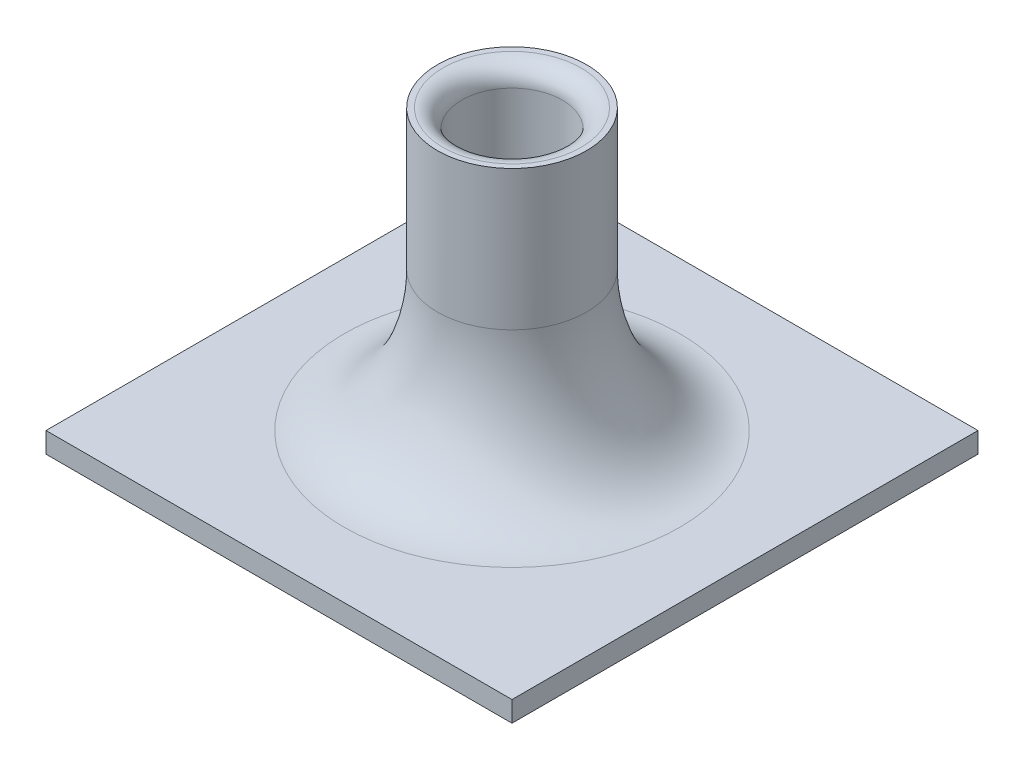
from build123d import *
from OCP.BRepFilletAPI import BRepFilletAPI_MakeChamfer

# Parameters (mm, degrees)
SKETCH_1_W          = 50
SKETCH_1_H          = 50
EXTRUDE_1_DEPTH     = 5
SKETCH_5_R          = 8
EXTRUDE_3_DEPTH     = 30
SKETCH_6_R          = 5.4
CUT_EXTRUDE_2_DEPTH = 50.749371855
FILLET_3_R          = 2
FILLET_2_SIZE       = 15
FILLET_2_SIZE_2     = 10
CHAMFER_1_SIZE      = 6
CHAMFER_1_SIZE2     = 2.797845949


with BuildPart() as part:
    # Эскиз1 → Бобышка-Вытянуть1 (new body)
    with BuildSketch(Plane(origin=(0, 0, 0), x_dir=(1, 0, 0), z_dir=(0, 1, 0))):
        Rectangle(SKETCH_1_W, SKETCH_1_H)
    extrude(amount=EXTRUDE_1_DEPTH)

    # Эскиз5 → Бобышка-Вытянуть3 (add)
    with BuildSketch(Plane(origin=(0, 5, 0), x_dir=(1, 0, 0), z_dir=(0, 1, 0))):
        with Locations(Location((0, 0, 0), (0, 0, 270))):
            Circle(SKETCH_5_R)
    extrude(amount=EXTRUDE_3_DEPTH)

    # Эскиз6 → Вырез-Вытянуть2 (cut, through all)
    with BuildSketch(Plane(origin=(0, 35, 0), x_dir=(1, 0, 0), z_dir=(0, 1, 0))):
        with Locations(Location((0, 0, 0), (0, 0, 270))):
            Circle(SKETCH_6_R)
    extrude(amount=-CUT_EXTRUDE_2_DEPTH, mode=Mode.SUBTRACT)

    # Скругление3
    fillet_3_edges = [part.edges().sort_by_distance(p)[0] for p in [
        (0, 35, -5.4),
    ]]
    fillet(fillet_3_edges, radius=FILLET_3_R)

    # Скругление2
    # an asymmetric fillet: 15, 10 mm, written as the material it adds along each edge
    with BuildSketch(Plane(origin=(0, 5, 0), x_dir=(0, 0, 1), z_dir=(-1, 0, 0))) as fillet_2_piece_1:
        with BuildLine():
            Bezier((8, FILLET_2_SIZE), (8, 0), (8 + FILLET_2_SIZE_2, 0), weights=[1, 0.707106781, 1])
            Line((8 + FILLET_2_SIZE_2, 0), (8, 0))
            Line((8, 0), (8, FILLET_2_SIZE))
        make_face()
    revolve(axis=Axis((0, 5, 0), (0, 1, 0)))

    # Фаска1: one chamfer whose edges measure the first distance from different faces: ONE call of the kernel's chamfer builder (chamfer() names one face for all edges)
    chamfer_1_edges_1 = [part.edges().sort_by_distance(p)[0] for p in [
        (0, 0, -5.4),
    ]]
    chamfer_1_side_1 = [part.faces().sort_by_distance(p)[0] for p in [
        (0, 16.5, -5.4),
    ]]
    chamfer_1_edges_2 = [part.edges().sort_by_distance(p)[0] for p in [
        (0, 0, 25),
        (-25, 0, 0),
        (0, 0, -25),
        (25, 0, 0),
    ]]
    chamfer_1_side_2 = [part.faces().sort_by_distance(p)[0] for p in [
        (0, 0, 24.292893219),
    ]]
    chamfer_1 = BRepFilletAPI_MakeChamfer(part.part.solid().wrapped)
    for e in chamfer_1_edges_1:
        chamfer_1.Add(CHAMFER_1_SIZE, CHAMFER_1_SIZE2, e.wrapped, chamfer_1_side_1[0].wrapped)  # the first distance lies on this face
    for e in chamfer_1_edges_2:
        chamfer_1.Add(CHAMFER_1_SIZE, CHAMFER_1_SIZE2, e.wrapped, chamfer_1_side_2[0].wrapped)  # the first distance lies on this face
    add(Compound.cast(chamfer_1.Shape()), mode=Mode.REPLACE)


solid = part.part
